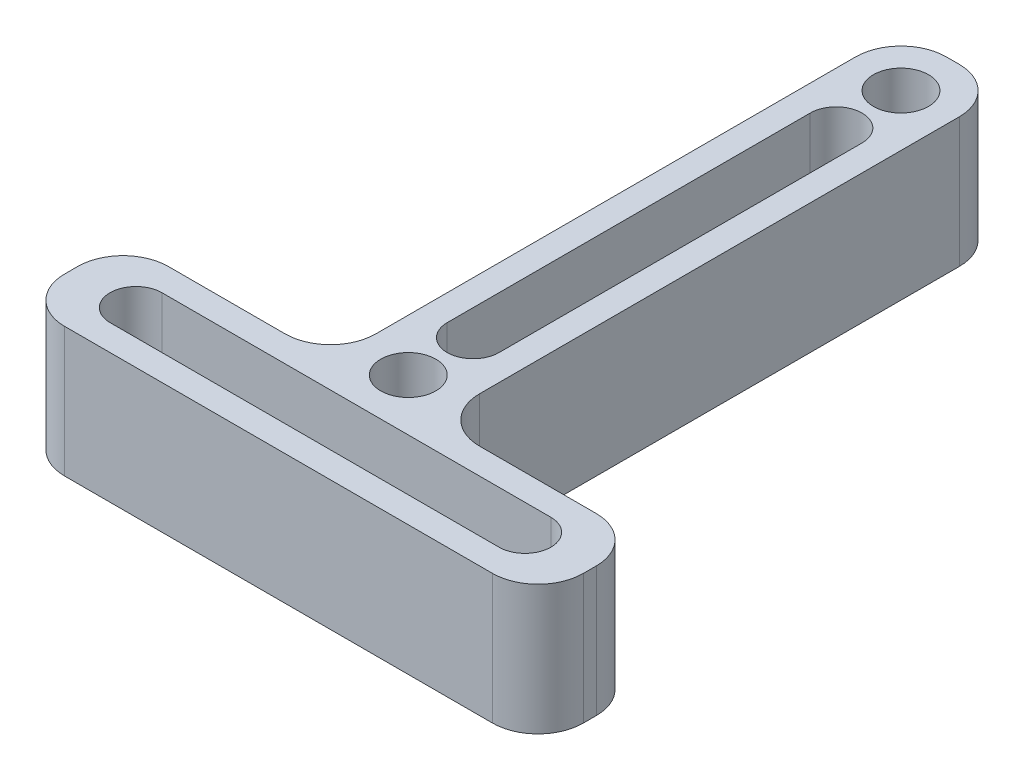
from build123d import *
from OCP.BRepFilletAPI import BRepFilletAPI_MakeChamfer

# Parameters (mm, degrees)
BOSS_EXTRUDE1_DEPTH = 20
SKETCH3_R           = 4.25
CUT_EXTRUDE1_DEPTH  = 18
CHAMFER1_SIZE       = 10
CHAMFER1_SIZE2      = 0.349207695
FILLET1_R           = 7
CUT_EXTRUDE2_DEPTH  = 91.35403779
CUT_EXTRUDE3_DEPTH  = 91.35403779


with BuildPart() as part:
    # Sketch2 → Boss-Extrude1 (new body)
    with BuildSketch(Plane(origin=(0, 0, 0), x_dir=(1, 0, 0), z_dir=(0, 1, 0))):
        Polygon((-8, 78.510204082), (8, 78.510204082), (8, -9.489795918), (40, -9.489795918), (40, -25.489795918), (-40, -25.489795918), (-40, -9.489795918), (-8, -9.489795918), align=None)
    extrude(amount=BOSS_EXTRUDE1_DEPTH)

    # Sketch3 → Cut-Extrude1 (cut)
    with BuildSketch(Plane(origin=(0, 20, 0), x_dir=(1, 0, 0), z_dir=(0, 1, 0))):
        with Locations((0, 70.510204082)):
            Circle(SKETCH3_R)
        with Locations((0, -5.489795918)):
            Circle(SKETCH3_R)
    extrude(amount=-CUT_EXTRUDE1_DEPTH, mode=Mode.SUBTRACT)

    # Chamfer1: one chamfer whose edges measure the first distance from different faces: ONE call of the kernel's chamfer builder (chamfer() names one face for all edges)
    chamfer1_edges_1 = [part.edges().sort_by_distance(p)[0] for p in [
        (-4.25, 2, 5.489795918),
    ]]
    chamfer1_side_1 = [part.faces().sort_by_distance(p)[0] for p in [
        (-4.25, 11, 5.489795918),
    ]]
    chamfer1_edges_2 = [part.edges().sort_by_distance(p)[0] for p in [
        (-4.25, 2, -70.510204082),
    ]]
    chamfer1_side_2 = [part.faces().sort_by_distance(p)[0] for p in [
        (-4.25, 11, -70.510204082),
    ]]
    chamfer1 = BRepFilletAPI_MakeChamfer(part.part.solid().wrapped)
    for e in chamfer1_edges_1:
        chamfer1.Add(CHAMFER1_SIZE, CHAMFER1_SIZE2, e.wrapped, chamfer1_side_1[0].wrapped)  # the first distance lies on this face
    for e in chamfer1_edges_2:
        chamfer1.Add(CHAMFER1_SIZE, CHAMFER1_SIZE2, e.wrapped, chamfer1_side_2[0].wrapped)  # the first distance lies on this face
    add(Compound.cast(chamfer1.Shape()), mode=Mode.REPLACE)

    # Fillet1
    fillet1_edges = [part.edges().sort_by_distance(p)[0] for p in [
        (40, 10, 9.489795918),
        (8, 10, 9.489795918),
        (8, 10, -78.510204082),
        (-8, 10, -78.510204082),
        (-8, 10, 9.489795918),
        (-40, 10, 9.489795918),
        (40, 10, 25.489795918),
        (-40, 10, 25.489795918),
    ]]
    fillet(fillet1_edges, radius=FILLET1_R)

    # Sketch4 → Cut-Extrude2 (cut, through all)
    with BuildSketch(Plane(origin=(0, 20, 0), x_dir=(1, 0, 0), z_dir=(0, 1, 0))):
        with BuildLine():
            Line((4, 60.510204082), (4, 4.510204082))
            ThreePointArc((4, 4.510204082), (0, 0.510204082), (-4, 4.510204082))
            Line((-4, 4.510204082), (-4, 60.510204082))
            ThreePointArc((-4, 60.510204082), (0, 64.510204082), (4, 60.510204082))
        make_face()
    extrude(amount=-CUT_EXTRUDE2_DEPTH, mode=Mode.SUBTRACT)

    # Sketch5 → Cut-Extrude3 (cut, through all)
    with BuildSketch(Plane(origin=(0, 20, 0), x_dir=(1, 0, 0), z_dir=(0, 1, 0))):
        with BuildLine():
            Line((-30, -13.489795918), (30, -13.489795918))
            ThreePointArc((30, -13.489795918), (34, -17.489795918), (30, -21.489795918))
            Line((30, -21.489795918), (-30, -21.489795918))
            ThreePointArc((-30, -21.489795918), (-34, -17.489795918), (-30, -13.489795918))
        make_face()
    extrude(amount=-CUT_EXTRUDE3_DEPTH, mode=Mode.SUBTRACT)


solid = part.part
